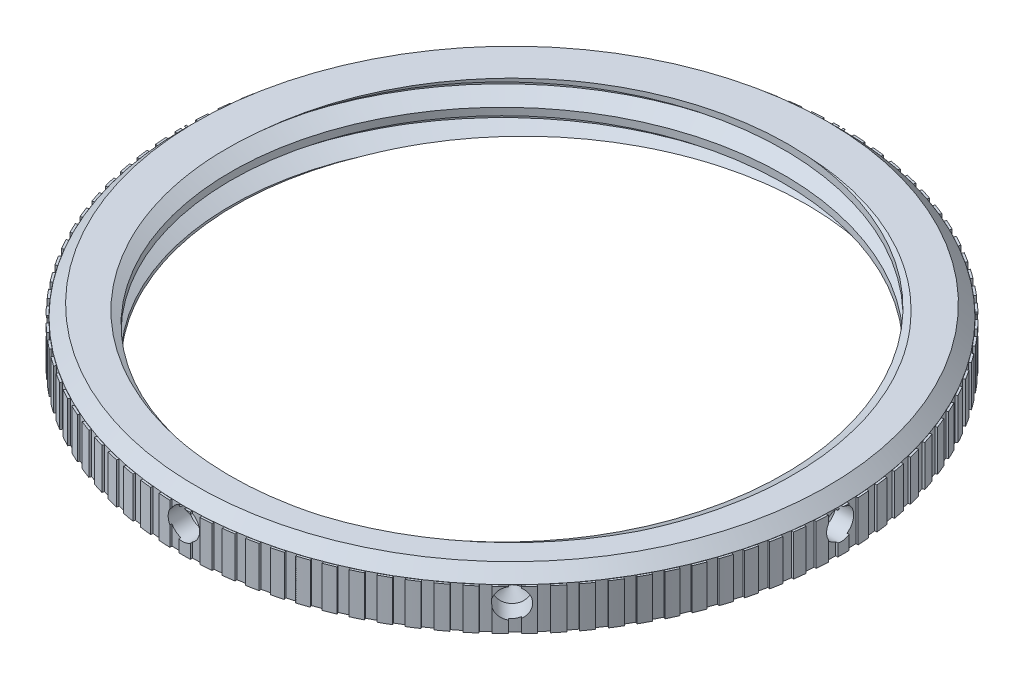
from build123d import *

# Parameters (mm, degrees)
SKETCH_1_R               = 5.6
SKETCH_1_R_2             = 5
EXTRUDE_1_DEPTH          = 0.9
CHAMFER_2_SIZE           = 0.2
THREAD_1_PITCH           = 0.5
THREAD_1_FROM            = 1
THREAD_1_TO              = 1.9
EXTRUDE_2_DEPTH          = 0.698
PATTERN_CIRCULAR_1_COUNT = 8


with BuildPart() as part:
    # Sketch 1 → 凸台-拉伸1 (new body)
    with BuildSketch(Plane.XZ.offset(4.597705057)):
        with Locations(Location((0, 0, 0), (0, 0, 270))):
            Circle(SKETCH_1_R)
        with Locations(Location((0, 0, 0), (0, 0, 270))):
            Circle(SKETCH_1_R_2, mode=Mode.SUBTRACT)
    extrude(amount=-EXTRUDE_1_DEPTH)

    # 倒角2
    chamfer_2_edges = [part.edges().sort_by_distance(p)[0] for p in [
        (0, -3.697705057, 5.6),
    ]]
    chamfer(chamfer_2_edges, length=CHAMFER_2_SIZE)

    # 螺纹线1: arcs per turn and ends read off the stored shape
    # 螺纹线1: the profile of Sketch 1 2 profile screwed along a right-hand helix through 3.8 turns, 6 arcs to a turn; built about Z, then put on its axis
    thread_1_z = Axis((0, 0, 0), (0, 0, 1))
    thread_1_corners = [(5.0003, 0, -0.000173205), (5.0003, 0, 0.437673204), (4.729367062, 0, 0.28125), (4.729367062, 0, 0.15625)]
    with BuildLine(mode=Mode.PRIVATE) as thread_1_profile:
        Line(thread_1_corners[0], thread_1_corners[1])
        Line(thread_1_corners[1], thread_1_corners[2])
        Line(thread_1_corners[2], thread_1_corners[3])
        Line(thread_1_corners[3], thread_1_corners[0])
    thread_1_cap = Face(thread_1_profile.wire())
    thread_1_turn_angles = [0, 30, 60, 90, 120, 150, 180, 210, 240, 270, 300, 330, 360]
    thread_1_turn_weights = [1, 0.8660254037844387, 1, 0.8660254037844387, 1, 0.8660254037844387, 1, 0.8660254037844387, 1, 0.8660254037844387, 1, 0.8660254037844387, 1]
    thread_1_turn_rails = [Edge.make_bspline([Vector(p[0], p[1], 0).rotate(thread_1_z, thread_1_turn_angles[k]) / thread_1_turn_weights[k] + Vector(0, 0, p[2] + THREAD_1_PITCH * thread_1_turn_angles[k] / 360) for k in range(13)], [0, 0, 0, 1, 1, 2, 2, 3, 3, 4, 4, 5, 5, 6, 6, 6], 2, thread_1_turn_weights) for p in thread_1_corners]
    thread_1_turn_sides = [Face.make_surface_from_curves(thread_1_turn_rails[p[0]], thread_1_turn_rails[p[1]]) for p in [(0, 1), (1, 2), (2, 3), (3, 0)]]
    thread_1_last_angles = [1080, 1110, 1140, 1170, 1200, 1230, 1260, 1290, 1320, 1344, 1368]
    thread_1_last_weights = [1, 0.8660254037844387, 1, 0.8660254037844387, 1, 0.8660254037844387, 1, 0.8660254037844387, 1, 0.9135454576426018, 1]
    thread_1_last_rails = [Edge.make_bspline([Vector(p[0], p[1], 0).rotate(thread_1_z, thread_1_last_angles[k]) / thread_1_last_weights[k] + Vector(0, 0, p[2] + THREAD_1_PITCH * thread_1_last_angles[k] / 360) for k in range(11)], [0, 0, 0, 1, 1, 2, 2, 3, 3, 4, 4, 5, 5, 5], 2, thread_1_last_weights) for p in thread_1_corners]
    thread_1_last_sides = [Face.make_surface_from_curves(thread_1_last_rails[p[0]], thread_1_last_rails[p[1]]) for p in [(0, 1), (1, 2), (2, 3), (3, 0)]]
    thread_1 = Plane(origin=(0, -5.597705057, 0), x_dir=(1, 0, 0), z_dir=(0, 1, 0)) * split(split(Solid(Shell([*[p.moved(Location((0, 0, THREAD_1_PITCH * i))) for i in range(3) for p in thread_1_turn_sides], *thread_1_last_sides, thread_1_cap, thread_1_cap.rotate(thread_1_z, 1368).moved(Location((0, 0, THREAD_1_PITCH * 1368 / 360)))])), bisect_by=Plane.XY.offset(THREAD_1_FROM), keep=Keep.TOP, mode=Mode.PRIVATE), bisect_by=Plane.XY.offset(THREAD_1_TO), keep=Keep.BOTTOM, mode=Mode.PRIVATE)
    add(thread_1)

    # 草图5 → 凸台-拉伸2 (add)
    with BuildSketch(Plane.XZ.offset(4.597705057)):
        with BuildLine():
            Line((3.18822103, 4.494267264), (3.341089976, 4.377593831))
            Line((3.341089976, 4.377593831), (3.419788422, 4.480706838))
            ThreePointArc((3.419788422, 4.480706838), (3.341068455, 4.539707942), (3.261330766, 4.597326207))
            Line((3.261330766, 4.597326207), (3.18822103, 4.494267264))
        make_face()
        with BuildLine():
            Line((2.966226774, 4.793035087), (2.899732428, 4.685588909))
            Line((2.899732428, 4.685588909), (3.059625707, 4.578744425))
            Line((3.059625707, 4.578744425), (3.131694341, 4.686595478))
            ThreePointArc((3.131694341, 4.686595478), (3.049424999, 4.740537289), (2.966226774, 4.793035087))
        make_face()
        with BuildLine():
            Line((2.659416439, 4.969828047), (2.599799907, 4.858418675))
            Line((2.599799907, 4.858418675), (2.766086493, 4.761824806))
            Line((2.766086493, 4.761824806), (2.831240892, 4.873988267))
            ThreePointArc((2.831240892, 4.873988267), (2.745746856, 4.922657902), (2.659416439, 4.969828047))
        make_face()
        with BuildLine():
            Line((2.342110603, 5.127007367), (2.289607163, 5.012074483))
            Line((2.289607163, 5.012074483), (2.4616308, 4.926112441))
            Line((2.4616308, 4.926112441), (2.51961383, 5.042145651))
            ThreePointArc((2.51961383, 5.042145651), (2.431232505, 5.085351033), (2.342110603, 5.127007367))
        make_face()
        with BuildLine():
            Line((2.015561527, 5.263952731), (1.970378385, 5.145949922))
            Line((1.970378385, 5.145949922), (2.147460174, 5.07095896))
            Line((2.147460174, 5.07095896), (2.198043002, 5.19040399))
            ThreePointArc((2.198043002, 5.19040399), (2.10712319, 5.227974606), (2.015561527, 5.263952731))
        make_face()
        with BuildLine():
            Line((1.68105795, 5.380123678), (1.643373425, 5.259516647))
            Line((1.643373425, 5.259516647), (1.824814505, 5.195792721))
            Line((1.824814505, 5.195792721), (1.867797503, 5.318178175))
            ThreePointArc((1.867797503, 5.318178175), (1.774698022, 5.349965752), (1.68105795, 5.380123678))
        make_face()
        with BuildLine():
            Line((1.339920005, 5.475061735), (1.30988282, 5.352326464))
            Line((1.30988282, 5.352326464), (1.494967126, 5.300121062))
            Line((1.494967126, 5.300121062), (1.530180661, 5.424963941))
            ThreePointArc((1.530180661, 5.424963941), (1.435268932, 5.450843028), (1.339920005, 5.475061735))
        make_face()
        with BuildLine():
            Line((0.993494008, 5.548392224), (0.971222706, 5.424013093))
            Line((0.971222706, 5.424013093), (1.159219795, 5.383532246))
            Line((1.159219795, 5.383532246), (1.186524895, 5.510339853))
            ThreePointArc((1.186524895, 5.510339853), (1.090175491, 5.530208316), (0.993494008, 5.548392224))
        make_face()
        with BuildLine():
            Line((0.643147145, 5.599825744), (0.62872962, 5.47429362))
            Line((0.62872962, 5.47429362), (0.818897552, 5.445697088))
            Line((0.818897552, 5.445697088), (0.838186457, 5.57396897))
            ThreePointArc((0.838186457, 5.57396897), (0.740779625, 5.587748399), (0.643147145, 5.599825744))
        make_face()
        with BuildLine():
            Line((0.290262073, 5.629159311), (0.283755225, 5.502969612))
            Line((0.283755225, 5.502969612), (0.475343496, 5.486370251))
            Line((0.475343496, 5.486370251), (0.48654008, 5.615600179))
            ThreePointArc((0.48654008, 5.615600179), (0.388460241, 5.623236191), (0.290262073, 5.629159311))
        make_face()
        with BuildLine():
            Line((-0.063768531, 5.636277157), (-0.062339022, 5.509927896))
            Line((-0.062339022, 5.509927896), (0.129913476, 5.505391218))
            Line((0.129913476, 5.505391218), (0.132973551, 5.635069179))
            ThreePointArc((0.132973551, 5.635069179), (0.034607781, 5.636531639), (-0.063768531, 5.636277157))
        make_face()
        with BuildLine():
            Line((-0.417547469, 5.621151193), (-0.408187245, 5.495141013))
            Line((-0.408187245, 5.495141013), (-0.216029254, 5.502684921))
            Line((-0.216029254, 5.502684921), (-0.221117763, 5.632299136))
            ThreePointArc((-0.221117763, 5.632299136), (-0.319381259, 5.627582272), (-0.417547469, 5.621151193))
        make_face()
        with BuildLine():
            Line((-0.769678538, 5.583841112), (-0.75242454, 5.458667318))
            Line((-0.75242454, 5.458667318), (-0.561119414, 5.47826204))
            Line((-0.561119414, 5.47826204), (-0.574336426, 5.607300981))
            ThreePointArc((-0.574336426, 5.607300981), (-0.672109848, 5.596423409), (-0.769678538, 5.583841112))
        make_face()
        with BuildLine():
            Line((-1.118772038, 5.524494162), (-1.093692359, 5.400650757))
            Line((-1.093692359, 5.400650757), (-0.903995093, 5.432218962))
            Line((-0.903995093, 5.432218962), (-0.925288446, 5.56017337))
            ThreePointArc((-0.925288446, 5.56017337), (-1.022185926, 5.543178019), (-1.118772038, 5.524494162))
        make_face()
        with BuildLine():
            Line((-1.463450255, 5.443344557), (-1.430643874, 5.321320295))
            Line((-1.430643874, 5.321320295), (-1.243303116, 5.364737397))
            Line((-1.243303116, 5.364737397), (-1.272588775, 5.491102296))
            ThreePointArc((-1.272588775, 5.491102296), (-1.368227903, 5.468056238), (-1.463450255, 5.443344557))
        make_face()
        with BuildLine():
            Line((-1.802352903, 5.340712558), (-1.761949291, 5.220989013))
            Line((-1.761949291, 5.220989013), (-1.577704389, 5.276083664))
            Line((-1.577704389, 5.276083664), (-1.614866778, 5.40036035))
            ThreePointArc((-1.614866778, 5.40036035), (-1.70887011, 5.371354537), (-1.802352903, 5.340712558))
        make_face()
        with BuildLine():
            Line((-2.134142488, 5.217003207), (-2.086301099, 5.100052872))
            Line((-2.086301099, 5.100052872), (-1.905879185, 5.16660764))
            Line((-1.905879185, 5.16660764), (-1.950771639, 5.288305648))
            ThreePointArc((-1.950771639, 5.288305648), (-2.042768187, 5.253454554), (-2.134142488, 5.217003207))
        make_face()
        with BuildLine():
            Line((-2.457509587, 5.072704727), (-2.40241923, 4.958989153))
            Line((-2.40241923, 4.958989153), (-2.226532345, 5.036741376))
            Line((-2.226532345, 5.036741376), (-2.278977696, 5.15538042))
            ThreePointArc((-2.278977696, 5.15538042), (-2.368604391, 5.114821586), (-2.457509587, 5.072704727))
        make_face()
        with BuildLine():
            Line((-2.771178018, 4.908386599), (-2.70905611, 4.798354569))
            Line((-2.70905611, 4.798354569), (-2.5383984, 4.886997395))
            Line((-2.5383984, 4.886997395), (-2.598189669, 5.002109261))
            ThreePointArc((-2.598189669, 5.002109261), (-2.685092796, 4.956002754), (-2.771178018, 4.908386599))
        make_face()
        with BuildLine():
            Line((-3.073909876, 4.724697312), (-3.005001582, 4.618783072))
            Line((-3.005001582, 4.618783072), (-2.840246556, 4.717966667))
            Line((-2.840246556, 4.717966667), (-2.907147775, 4.829097062))
            ThreePointArc((-2.907147775, 4.829097062), (-2.990984367, 4.777624842), (-3.073909876, 4.724697312))
        make_face()
        with BuildLine():
            Line((-3.364510416, 4.522361803), (-3.289087687, 4.420983348))
            Line((-3.289087687, 4.420983348), (-3.130885556, 4.530316281))
            Line((-3.130885556, 4.530316281), (-3.204632696, 4.637026623))
            ThreePointArc((-3.204632696, 4.637026623), (-3.285071888, 4.580391829), (-3.364510416, 4.522361803))
        make_face()
        with BuildLine():
            Line((-3.64183277, 4.302178598), (-3.560193265, 4.205736023))
            Line((-3.560193265, 4.205736023), (-3.409168382, 4.324786806))
            Line((-3.409168382, 4.324786806), (-3.489470396, 4.426655958))
            ThreePointArc((-3.489470396, 4.426655958), (-3.566194732, 4.365082101), (-3.64183277, 4.302178598))
        make_face()
        with BuildLine():
            Line((-3.904782474, 4.06501666), (-3.817248387, 3.973890579))
            Line((-3.817248387, 3.973890579), (-3.673996777, 4.102189373))
            Line((-3.673996777, 4.102189373), (-3.760536751, 4.198815305))
            ThreePointArc((-3.760536751, 4.198815305), (-3.833243434, 4.132545389), (-3.904782474, 4.06501666))
        make_face()
        with BuildLine():
            Line((-4.152321786, 3.811811958), (-4.059238573, 3.726362004))
            Line((-4.059238573, 3.726362004), (-3.924325586, 3.863402473))
            Line((-3.924325586, 3.863402473), (-4.016761985, 3.954403846))
            ThreePointArc((-4.016761985, 3.954403846), (-4.085164076, 3.883699408), (-4.152321786, 3.811811958))
        make_face()
        with BuildLine():
            Line((-4.383473781, 3.543563776), (-4.285208799, 3.464127181))
            Line((-4.285208799, 3.464127181), (-4.159166874, 3.609368489))
            Line((-4.159166874, 3.609368489), (-4.257134895, 3.694386161))
            ThreePointArc((-4.257134895, 3.694386161), (-4.320962441, 3.61952624), (-4.383473781, 3.543563776))
        make_face()
        with BuildLine():
            Line((-4.597326207, 3.261330766), (-4.494267264, 3.18822103))
            Line((-4.494267264, 3.18822103), (-4.377593831, 3.341089976))
            Line((-4.377593831, 3.341089976), (-4.480706838, 3.419788422))
            ThreePointArc((-4.480706838, 3.419788422), (-4.539707942, 3.341068455), (-4.597326207, 3.261330766))
        make_face()
        with BuildLine():
            Line((-4.793035087, 2.966226774), (-4.685588909, 2.899732428))
            Line((-4.685588909, 2.899732428), (-4.578744425, 3.059625707))
            Line((-4.578744425, 3.059625707), (-4.686595478, 3.131694341))
            ThreePointArc((-4.686595478, 3.131694341), (-4.740537289, 3.049424999), (-4.793035087, 2.966226774))
        make_face()
        with BuildLine():
            Line((-4.969828047, 2.659416439), (-4.858418675, 2.599799907))
            Line((-4.858418675, 2.599799907), (-4.761824806, 2.766086493))
            Line((-4.761824806, 2.766086493), (-4.873988267, 2.831240892))
            ThreePointArc((-4.873988267, 2.831240892), (-4.922657902, 2.745746856), (-4.969828047, 2.659416439))
        make_face()
        with BuildLine():
            Line((-5.127007367, 2.342110603), (-5.012074483, 2.289607163))
            Line((-5.012074483, 2.289607163), (-4.926112441, 2.4616308))
            Line((-4.926112441, 2.4616308), (-5.042145651, 2.51961383))
            ThreePointArc((-5.042145651, 2.51961383), (-5.085351033, 2.431232505), (-5.127007367, 2.342110603))
        make_face()
        with BuildLine():
            Line((-5.263952731, 2.015561527), (-5.145949922, 1.970378385))
            Line((-5.145949922, 1.970378385), (-5.07095896, 2.147460174))
            Line((-5.07095896, 2.147460174), (-5.19040399, 2.198043002))
            ThreePointArc((-5.19040399, 2.198043002), (-5.227974606, 2.10712319), (-5.263952731, 2.015561527))
        make_face()
        with BuildLine():
            Line((-5.380123678, 1.68105795), (-5.259516647, 1.643373425))
            Line((-5.259516647, 1.643373425), (-5.195792721, 1.824814505))
            Line((-5.195792721, 1.824814505), (-5.318178175, 1.867797503))
            ThreePointArc((-5.318178175, 1.867797503), (-5.349965752, 1.774698022), (-5.380123678, 1.68105795))
        make_face()
        with BuildLine():
            Line((-5.475061735, 1.339920005), (-5.352326464, 1.30988282))
            Line((-5.352326464, 1.30988282), (-5.300121062, 1.494967126))
            Line((-5.300121062, 1.494967126), (-5.424963941, 1.530180661))
            ThreePointArc((-5.424963941, 1.530180661), (-5.450843028, 1.435268932), (-5.475061735, 1.339920005))
        make_face()
        with BuildLine():
            Line((-5.548392224, 0.993494008), (-5.424013093, 0.971222706))
            Line((-5.424013093, 0.971222706), (-5.383532246, 1.159219795))
            Line((-5.383532246, 1.159219795), (-5.510339853, 1.186524895))
            ThreePointArc((-5.510339853, 1.186524895), (-5.530208316, 1.090175491), (-5.548392224, 0.993494008))
        make_face()
        with BuildLine():
            Line((-5.599825744, 0.643147145), (-5.47429362, 0.62872962))
            Line((-5.47429362, 0.62872962), (-5.445697088, 0.818897552))
            Line((-5.445697088, 0.818897552), (-5.57396897, 0.838186457))
            ThreePointArc((-5.57396897, 0.838186457), (-5.587748399, 0.740779625), (-5.599825744, 0.643147145))
        make_face()
        with BuildLine():
            Line((-5.629159311, 0.290262073), (-5.502969612, 0.283755225))
            Line((-5.502969612, 0.283755225), (-5.486370251, 0.475343496))
            Line((-5.486370251, 0.475343496), (-5.615600179, 0.48654008))
            ThreePointArc((-5.615600179, 0.48654008), (-5.623236191, 0.388460241), (-5.629159311, 0.290262073))
        make_face()
        with BuildLine():
            Line((-5.636277157, -0.063768531), (-5.509927896, -0.062339022))
            Line((-5.509927896, -0.062339022), (-5.505391218, 0.129913476))
            Line((-5.505391218, 0.129913476), (-5.635069179, 0.132973551))
            ThreePointArc((-5.635069179, 0.132973551), (-5.636531639, 0.034607781), (-5.636277157, -0.063768531))
        make_face()
        with BuildLine():
            Line((-5.621151193, -0.417547469), (-5.495141013, -0.408187245))
            Line((-5.495141013, -0.408187245), (-5.502684921, -0.216029254))
            Line((-5.502684921, -0.216029254), (-5.632299136, -0.221117763))
            ThreePointArc((-5.632299136, -0.221117763), (-5.627582272, -0.319381259), (-5.621151193, -0.417547469))
        make_face()
        with BuildLine():
            Line((-5.583841112, -0.769678538), (-5.458667318, -0.75242454))
            Line((-5.458667318, -0.75242454), (-5.47826204, -0.561119414))
            Line((-5.47826204, -0.561119414), (-5.607300981, -0.574336426))
            ThreePointArc((-5.607300981, -0.574336426), (-5.596423409, -0.672109848), (-5.583841112, -0.769678538))
        make_face()
        with BuildLine():
            Line((-5.524494162, -1.118772038), (-5.400650757, -1.093692359))
            Line((-5.400650757, -1.093692359), (-5.432218962, -0.903995093))
            Line((-5.432218962, -0.903995093), (-5.56017337, -0.925288446))
            ThreePointArc((-5.56017337, -0.925288446), (-5.543178019, -1.022185926), (-5.524494162, -1.118772038))
        make_face()
        with BuildLine():
            Line((-5.443344557, -1.463450255), (-5.321320295, -1.430643874))
            Line((-5.321320295, -1.430643874), (-5.364737397, -1.243303116))
            Line((-5.364737397, -1.243303116), (-5.491102296, -1.272588775))
            ThreePointArc((-5.491102296, -1.272588775), (-5.468056238, -1.368227903), (-5.443344557, -1.463450255))
        make_face()
        with BuildLine():
            Line((-5.340712558, -1.802352903), (-5.220989013, -1.761949291))
            Line((-5.220989013, -1.761949291), (-5.276083664, -1.577704389))
            Line((-5.276083664, -1.577704389), (-5.40036035, -1.614866778))
            ThreePointArc((-5.40036035, -1.614866778), (-5.371354537, -1.70887011), (-5.340712558, -1.802352903))
        make_face()
        with BuildLine():
            Line((-5.217003207, -2.134142488), (-5.100052872, -2.086301099))
            Line((-5.100052872, -2.086301099), (-5.16660764, -1.905879185))
            Line((-5.16660764, -1.905879185), (-5.288305648, -1.950771639))
            ThreePointArc((-5.288305648, -1.950771639), (-5.253454554, -2.042768187), (-5.217003207, -2.134142488))
        make_face()
        with BuildLine():
            Line((-5.072704727, -2.457509587), (-4.958989153, -2.40241923))
            Line((-4.958989153, -2.40241923), (-5.036741376, -2.226532345))
            Line((-5.036741376, -2.226532345), (-5.15538042, -2.278977696))
            ThreePointArc((-5.15538042, -2.278977696), (-5.114821586, -2.368604391), (-5.072704727, -2.457509587))
        make_face()
        with BuildLine():
            Line((-4.908386599, -2.771178018), (-4.798354569, -2.70905611))
            Line((-4.798354569, -2.70905611), (-4.886997395, -2.5383984))
            Line((-4.886997395, -2.5383984), (-5.002109261, -2.598189669))
            ThreePointArc((-5.002109261, -2.598189669), (-4.956002754, -2.685092796), (-4.908386599, -2.771178018))
        make_face()
        with BuildLine():
            Line((-4.724697312, -3.073909876), (-4.618783072, -3.005001582))
            Line((-4.618783072, -3.005001582), (-4.717966667, -2.840246556))
            Line((-4.717966667, -2.840246556), (-4.829097062, -2.907147775))
            ThreePointArc((-4.829097062, -2.907147775), (-4.777624842, -2.990984367), (-4.724697312, -3.073909876))
        make_face()
        with BuildLine():
            Line((-4.522361803, -3.364510416), (-4.420983348, -3.289087687))
            Line((-4.420983348, -3.289087687), (-4.530316281, -3.130885556))
            Line((-4.530316281, -3.130885556), (-4.637026623, -3.204632696))
            ThreePointArc((-4.637026623, -3.204632696), (-4.580391829, -3.285071888), (-4.522361803, -3.364510416))
        make_face()
        with BuildLine():
            Line((-4.302178598, -3.64183277), (-4.205736023, -3.560193265))
            Line((-4.205736023, -3.560193265), (-4.324786806, -3.409168382))
            Line((-4.324786806, -3.409168382), (-4.426655958, -3.489470396))
            ThreePointArc((-4.426655958, -3.489470396), (-4.365082101, -3.566194732), (-4.302178598, -3.64183277))
        make_face()
        with BuildLine():
            Line((-4.06501666, -3.904782474), (-3.973890579, -3.817248387))
            Line((-3.973890579, -3.817248387), (-4.102189373, -3.673996777))
            Line((-4.102189373, -3.673996777), (-4.198815305, -3.760536751))
            ThreePointArc((-4.198815305, -3.760536751), (-4.132545389, -3.833243434), (-4.06501666, -3.904782474))
        make_face()
        with BuildLine():
            Line((-3.811811958, -4.152321786), (-3.726362004, -4.059238573))
            Line((-3.726362004, -4.059238573), (-3.863402473, -3.924325586))
            Line((-3.863402473, -3.924325586), (-3.954403846, -4.016761985))
            ThreePointArc((-3.954403846, -4.016761985), (-3.883699408, -4.085164076), (-3.811811958, -4.152321786))
        make_face()
        with BuildLine():
            Line((-3.543563776, -4.383473781), (-3.464127181, -4.285208799))
            Line((-3.464127181, -4.285208799), (-3.609368489, -4.159166874))
            Line((-3.609368489, -4.159166874), (-3.694386161, -4.257134895))
            ThreePointArc((-3.694386161, -4.257134895), (-3.61952624, -4.320962441), (-3.543563776, -4.383473781))
        make_face()
        with BuildLine():
            Line((-3.261330766, -4.597326207), (-3.18822103, -4.494267264))
            Line((-3.18822103, -4.494267264), (-3.341089976, -4.377593831))
            Line((-3.341089976, -4.377593831), (-3.419788422, -4.480706838))
            ThreePointArc((-3.419788422, -4.480706838), (-3.341068455, -4.539707942), (-3.261330766, -4.597326207))
        make_face()
        with BuildLine():
            Line((-2.966226774, -4.793035087), (-2.899732428, -4.685588909))
            Line((-2.899732428, -4.685588909), (-3.059625707, -4.578744425))
            Line((-3.059625707, -4.578744425), (-3.131694341, -4.686595478))
            ThreePointArc((-3.131694341, -4.686595478), (-3.049424999, -4.740537289), (-2.966226774, -4.793035087))
        make_face()
        with BuildLine():
            Line((-2.659416439, -4.969828047), (-2.599799907, -4.858418675))
            Line((-2.599799907, -4.858418675), (-2.766086493, -4.761824806))
            Line((-2.766086493, -4.761824806), (-2.831240892, -4.873988267))
            ThreePointArc((-2.831240892, -4.873988267), (-2.745746856, -4.922657902), (-2.659416439, -4.969828047))
        make_face()
        with BuildLine():
            Line((-2.342110603, -5.127007367), (-2.289607163, -5.012074483))
            Line((-2.289607163, -5.012074483), (-2.4616308, -4.926112441))
            Line((-2.4616308, -4.926112441), (-2.51961383, -5.042145651))
            ThreePointArc((-2.51961383, -5.042145651), (-2.431232505, -5.085351033), (-2.342110603, -5.127007367))
        make_face()
        with BuildLine():
            Line((-2.015561527, -5.263952731), (-1.970378385, -5.145949922))
            Line((-1.970378385, -5.145949922), (-2.147460174, -5.07095896))
            Line((-2.147460174, -5.07095896), (-2.198043002, -5.19040399))
            ThreePointArc((-2.198043002, -5.19040399), (-2.10712319, -5.227974606), (-2.015561527, -5.263952731))
        make_face()
        with BuildLine():
            Line((-1.68105795, -5.380123678), (-1.643373425, -5.259516647))
            Line((-1.643373425, -5.259516647), (-1.824814505, -5.195792721))
            Line((-1.824814505, -5.195792721), (-1.867797503, -5.318178175))
            ThreePointArc((-1.867797503, -5.318178175), (-1.774698022, -5.349965752), (-1.68105795, -5.380123678))
        make_face()
        with BuildLine():
            Line((-1.339920005, -5.475061735), (-1.30988282, -5.352326464))
            Line((-1.30988282, -5.352326464), (-1.494967126, -5.300121062))
            Line((-1.494967126, -5.300121062), (-1.530180661, -5.424963941))
            ThreePointArc((-1.530180661, -5.424963941), (-1.435268932, -5.450843028), (-1.339920005, -5.475061735))
        make_face()
        with BuildLine():
            Line((-0.993494008, -5.548392224), (-0.971222706, -5.424013093))
            Line((-0.971222706, -5.424013093), (-1.159219795, -5.383532246))
            Line((-1.159219795, -5.383532246), (-1.186524895, -5.510339853))
            ThreePointArc((-1.186524895, -5.510339853), (-1.090175491, -5.530208316), (-0.993494008, -5.548392224))
        make_face()
        with BuildLine():
            Line((-0.643147145, -5.599825744), (-0.62872962, -5.47429362))
            Line((-0.62872962, -5.47429362), (-0.818897552, -5.445697088))
            Line((-0.818897552, -5.445697088), (-0.838186457, -5.57396897))
            ThreePointArc((-0.838186457, -5.57396897), (-0.740779625, -5.587748399), (-0.643147145, -5.599825744))
        make_face()
        with BuildLine():
            Line((-0.290262073, -5.629159311), (-0.283755225, -5.502969612))
            Line((-0.283755225, -5.502969612), (-0.475343496, -5.486370251))
            Line((-0.475343496, -5.486370251), (-0.48654008, -5.615600179))
            ThreePointArc((-0.48654008, -5.615600179), (-0.388460241, -5.623236191), (-0.290262073, -5.629159311))
        make_face()
        with BuildLine():
            Line((0.063768531, -5.636277157), (0.062339022, -5.509927896))
            Line((0.062339022, -5.509927896), (-0.129913476, -5.505391218))
            Line((-0.129913476, -5.505391218), (-0.132973551, -5.635069179))
            ThreePointArc((-0.132973551, -5.635069179), (-0.034607781, -5.636531639), (0.063768531, -5.636277157))
        make_face()
        with BuildLine():
            Line((0.417547469, -5.621151193), (0.408187245, -5.495141013))
            Line((0.408187245, -5.495141013), (0.216029254, -5.502684921))
            Line((0.216029254, -5.502684921), (0.221117763, -5.632299136))
            ThreePointArc((0.221117763, -5.632299136), (0.319381259, -5.627582272), (0.417547469, -5.621151193))
        make_face()
        with BuildLine():
            Line((0.769678538, -5.583841112), (0.75242454, -5.458667318))
            Line((0.75242454, -5.458667318), (0.561119414, -5.47826204))
            Line((0.561119414, -5.47826204), (0.574336426, -5.607300981))
            ThreePointArc((0.574336426, -5.607300981), (0.672109848, -5.596423409), (0.769678538, -5.583841112))
        make_face()
        with BuildLine():
            Line((1.118772038, -5.524494162), (1.093692359, -5.400650757))
            Line((1.093692359, -5.400650757), (0.903995093, -5.432218962))
            Line((0.903995093, -5.432218962), (0.925288446, -5.56017337))
            ThreePointArc((0.925288446, -5.56017337), (1.022185926, -5.543178019), (1.118772038, -5.524494162))
        make_face()
        with BuildLine():
            Line((1.463450255, -5.443344557), (1.430643874, -5.321320295))
            Line((1.430643874, -5.321320295), (1.243303116, -5.364737397))
            Line((1.243303116, -5.364737397), (1.272588775, -5.491102296))
            ThreePointArc((1.272588775, -5.491102296), (1.368227903, -5.468056238), (1.463450255, -5.443344557))
        make_face()
        with BuildLine():
            Line((1.802352903, -5.340712558), (1.761949291, -5.220989013))
            Line((1.761949291, -5.220989013), (1.577704389, -5.276083664))
            Line((1.577704389, -5.276083664), (1.614866778, -5.40036035))
            ThreePointArc((1.614866778, -5.40036035), (1.70887011, -5.371354537), (1.802352903, -5.340712558))
        make_face()
        with BuildLine():
            Line((2.134142488, -5.217003207), (2.086301099, -5.100052872))
            Line((2.086301099, -5.100052872), (1.905879185, -5.16660764))
            Line((1.905879185, -5.16660764), (1.950771639, -5.288305648))
            ThreePointArc((1.950771639, -5.288305648), (2.042768187, -5.253454554), (2.134142488, -5.217003207))
        make_face()
        with BuildLine():
            Line((2.457509587, -5.072704727), (2.40241923, -4.958989153))
            Line((2.40241923, -4.958989153), (2.226532345, -5.036741376))
            Line((2.226532345, -5.036741376), (2.278977696, -5.15538042))
            ThreePointArc((2.278977696, -5.15538042), (2.368604391, -5.114821586), (2.457509587, -5.072704727))
        make_face()
        with BuildLine():
            Line((2.771178018, -4.908386599), (2.70905611, -4.798354569))
            Line((2.70905611, -4.798354569), (2.5383984, -4.886997395))
            Line((2.5383984, -4.886997395), (2.598189669, -5.002109261))
            ThreePointArc((2.598189669, -5.002109261), (2.685092796, -4.956002754), (2.771178018, -4.908386599))
        make_face()
        with BuildLine():
            Line((3.073909876, -4.724697312), (3.005001582, -4.618783072))
            Line((3.005001582, -4.618783072), (2.840246556, -4.717966667))
            Line((2.840246556, -4.717966667), (2.907147775, -4.829097062))
            ThreePointArc((2.907147775, -4.829097062), (2.990984367, -4.777624842), (3.073909876, -4.724697312))
        make_face()
        with BuildLine():
            Line((3.364510416, -4.522361803), (3.289087687, -4.420983348))
            Line((3.289087687, -4.420983348), (3.130885556, -4.530316281))
            Line((3.130885556, -4.530316281), (3.204632696, -4.637026623))
            ThreePointArc((3.204632696, -4.637026623), (3.285071888, -4.580391829), (3.364510416, -4.522361803))
        make_face()
        with BuildLine():
            Line((3.64183277, -4.302178598), (3.560193265, -4.205736023))
            Line((3.560193265, -4.205736023), (3.409168382, -4.324786806))
            Line((3.409168382, -4.324786806), (3.489470396, -4.426655958))
            ThreePointArc((3.489470396, -4.426655958), (3.566194732, -4.365082101), (3.64183277, -4.302178598))
        make_face()
        with BuildLine():
            Line((3.904782474, -4.06501666), (3.817248387, -3.973890579))
            Line((3.817248387, -3.973890579), (3.673996777, -4.102189373))
            Line((3.673996777, -4.102189373), (3.760536751, -4.198815305))
            ThreePointArc((3.760536751, -4.198815305), (3.833243434, -4.132545389), (3.904782474, -4.06501666))
        make_face()
        with BuildLine():
            Line((4.152321786, -3.811811958), (4.059238573, -3.726362004))
            Line((4.059238573, -3.726362004), (3.924325586, -3.863402473))
            Line((3.924325586, -3.863402473), (4.016761985, -3.954403846))
            ThreePointArc((4.016761985, -3.954403846), (4.085164076, -3.883699408), (4.152321786, -3.811811958))
        make_face()
        with BuildLine():
            Line((4.383473781, -3.543563776), (4.285208799, -3.464127181))
            Line((4.285208799, -3.464127181), (4.159166874, -3.609368489))
            Line((4.159166874, -3.609368489), (4.257134895, -3.694386161))
            ThreePointArc((4.257134895, -3.694386161), (4.320962441, -3.61952624), (4.383473781, -3.543563776))
        make_face()
        with BuildLine():
            Line((4.597326207, -3.261330766), (4.494267264, -3.18822103))
            Line((4.494267264, -3.18822103), (4.377593831, -3.341089976))
            Line((4.377593831, -3.341089976), (4.480706838, -3.419788422))
            ThreePointArc((4.480706838, -3.419788422), (4.539707942, -3.341068455), (4.597326207, -3.261330766))
        make_face()
        with BuildLine():
            Line((4.793035087, -2.966226774), (4.685588909, -2.899732428))
            Line((4.685588909, -2.899732428), (4.578744425, -3.059625707))
            Line((4.578744425, -3.059625707), (4.686595478, -3.131694341))
            ThreePointArc((4.686595478, -3.131694341), (4.740537289, -3.049424999), (4.793035087, -2.966226774))
        make_face()
        with BuildLine():
            Line((4.969828047, -2.659416439), (4.858418675, -2.599799907))
            Line((4.858418675, -2.599799907), (4.761824806, -2.766086493))
            Line((4.761824806, -2.766086493), (4.873988267, -2.831240892))
            ThreePointArc((4.873988267, -2.831240892), (4.922657902, -2.745746856), (4.969828047, -2.659416439))
        make_face()
        with BuildLine():
            Line((5.127007367, -2.342110603), (5.012074483, -2.289607163))
            Line((5.012074483, -2.289607163), (4.926112441, -2.4616308))
            Line((4.926112441, -2.4616308), (5.042145651, -2.51961383))
            ThreePointArc((5.042145651, -2.51961383), (5.085351033, -2.431232505), (5.127007367, -2.342110603))
        make_face()
        with BuildLine():
            Line((5.263952731, -2.015561527), (5.145949922, -1.970378385))
            Line((5.145949922, -1.970378385), (5.07095896, -2.147460174))
            Line((5.07095896, -2.147460174), (5.19040399, -2.198043002))
            ThreePointArc((5.19040399, -2.198043002), (5.227974606, -2.10712319), (5.263952731, -2.015561527))
        make_face()
        with BuildLine():
            Line((5.380123678, -1.68105795), (5.259516647, -1.643373425))
            Line((5.259516647, -1.643373425), (5.195792721, -1.824814505))
            Line((5.195792721, -1.824814505), (5.318178175, -1.867797503))
            ThreePointArc((5.318178175, -1.867797503), (5.349965752, -1.774698022), (5.380123678, -1.68105795))
        make_face()
        with BuildLine():
            Line((5.475061735, -1.339920005), (5.352326464, -1.30988282))
            Line((5.352326464, -1.30988282), (5.300121062, -1.494967126))
            Line((5.300121062, -1.494967126), (5.424963941, -1.530180661))
            ThreePointArc((5.424963941, -1.530180661), (5.450843028, -1.435268932), (5.475061735, -1.339920005))
        make_face()
        with BuildLine():
            Line((5.548392224, -0.993494008), (5.424013093, -0.971222706))
            Line((5.424013093, -0.971222706), (5.383532246, -1.159219795))
            Line((5.383532246, -1.159219795), (5.510339853, -1.186524895))
            ThreePointArc((5.510339853, -1.186524895), (5.530208316, -1.090175491), (5.548392224, -0.993494008))
        make_face()
        with BuildLine():
            Line((5.599825744, -0.643147145), (5.47429362, -0.62872962))
            Line((5.47429362, -0.62872962), (5.445697088, -0.818897552))
            Line((5.445697088, -0.818897552), (5.57396897, -0.838186457))
            ThreePointArc((5.57396897, -0.838186457), (5.587748399, -0.740779625), (5.599825744, -0.643147145))
        make_face()
        with BuildLine():
            Line((5.629159311, -0.290262073), (5.502969612, -0.283755225))
            Line((5.502969612, -0.283755225), (5.486370251, -0.475343496))
            Line((5.486370251, -0.475343496), (5.615600179, -0.48654008))
            ThreePointArc((5.615600179, -0.48654008), (5.623236191, -0.388460241), (5.629159311, -0.290262073))
        make_face()
        with BuildLine():
            Line((5.636277157, 0.063768531), (5.509927896, 0.062339022))
            Line((5.509927896, 0.062339022), (5.505391218, -0.129913476))
            Line((5.505391218, -0.129913476), (5.635069179, -0.132973551))
            ThreePointArc((5.635069179, -0.132973551), (5.636531639, -0.034607781), (5.636277157, 0.063768531))
        make_face()
        with BuildLine():
            Line((5.621151193, 0.417547469), (5.495141013, 0.408187245))
            Line((5.495141013, 0.408187245), (5.502684921, 0.216029254))
            Line((5.502684921, 0.216029254), (5.632299136, 0.221117763))
            ThreePointArc((5.632299136, 0.221117763), (5.627582272, 0.319381259), (5.621151193, 0.417547469))
        make_face()
        with BuildLine():
            Line((5.583841112, 0.769678538), (5.458667318, 0.75242454))
            Line((5.458667318, 0.75242454), (5.47826204, 0.561119414))
            Line((5.47826204, 0.561119414), (5.607300981, 0.574336426))
            ThreePointArc((5.607300981, 0.574336426), (5.596423409, 0.672109848), (5.583841112, 0.769678538))
        make_face()
        with BuildLine():
            Line((5.524494162, 1.118772038), (5.400650757, 1.093692359))
            Line((5.400650757, 1.093692359), (5.432218962, 0.903995093))
            Line((5.432218962, 0.903995093), (5.56017337, 0.925288446))
            ThreePointArc((5.56017337, 0.925288446), (5.543178019, 1.022185926), (5.524494162, 1.118772038))
        make_face()
        with BuildLine():
            Line((5.443344557, 1.463450255), (5.321320295, 1.430643874))
            Line((5.321320295, 1.430643874), (5.364737397, 1.243303116))
            Line((5.364737397, 1.243303116), (5.491102296, 1.272588775))
            ThreePointArc((5.491102296, 1.272588775), (5.468056238, 1.368227903), (5.443344557, 1.463450255))
        make_face()
        with BuildLine():
            Line((5.340712558, 1.802352903), (5.220989013, 1.761949291))
            Line((5.220989013, 1.761949291), (5.276083664, 1.577704389))
            Line((5.276083664, 1.577704389), (5.40036035, 1.614866778))
            ThreePointArc((5.40036035, 1.614866778), (5.371354537, 1.70887011), (5.340712558, 1.802352903))
        make_face()
        with BuildLine():
            Line((5.217003207, 2.134142488), (5.100052872, 2.086301099))
            Line((5.100052872, 2.086301099), (5.16660764, 1.905879185))
            Line((5.16660764, 1.905879185), (5.288305648, 1.950771639))
            ThreePointArc((5.288305648, 1.950771639), (5.253454554, 2.042768187), (5.217003207, 2.134142488))
        make_face()
        with BuildLine():
            Line((5.072704727, 2.457509587), (4.958989153, 2.40241923))
            Line((4.958989153, 2.40241923), (5.036741376, 2.226532345))
            Line((5.036741376, 2.226532345), (5.15538042, 2.278977696))
            ThreePointArc((5.15538042, 2.278977696), (5.114821586, 2.368604391), (5.072704727, 2.457509587))
        make_face()
        with BuildLine():
            Line((4.908386599, 2.771178018), (4.798354569, 2.70905611))
            Line((4.798354569, 2.70905611), (4.886997395, 2.5383984))
            Line((4.886997395, 2.5383984), (5.002109261, 2.598189669))
            ThreePointArc((5.002109261, 2.598189669), (4.956002754, 2.685092796), (4.908386599, 2.771178018))
        make_face()
        with BuildLine():
            Line((4.724697312, 3.073909876), (4.618783072, 3.005001582))
            Line((4.618783072, 3.005001582), (4.717966667, 2.840246556))
            Line((4.717966667, 2.840246556), (4.829097062, 2.907147775))
            ThreePointArc((4.829097062, 2.907147775), (4.777624842, 2.990984367), (4.724697312, 3.073909876))
        make_face()
        with BuildLine():
            Line((4.522361803, 3.364510416), (4.420983348, 3.289087687))
            Line((4.420983348, 3.289087687), (4.530316281, 3.130885556))
            Line((4.530316281, 3.130885556), (4.637026623, 3.204632696))
            ThreePointArc((4.637026623, 3.204632696), (4.580391829, 3.285071888), (4.522361803, 3.364510416))
        make_face()
        with BuildLine():
            Line((4.302178598, 3.64183277), (4.205736023, 3.560193265))
            Line((4.205736023, 3.560193265), (4.324786806, 3.409168382))
            Line((4.324786806, 3.409168382), (4.426655958, 3.489470396))
            ThreePointArc((4.426655958, 3.489470396), (4.365082101, 3.566194732), (4.302178598, 3.64183277))
        make_face()
        with BuildLine():
            Line((4.06501666, 3.904782474), (3.973890579, 3.817248387))
            Line((3.973890579, 3.817248387), (4.102189373, 3.673996777))
            Line((4.102189373, 3.673996777), (4.198815305, 3.760536751))
            ThreePointArc((4.198815305, 3.760536751), (4.132545389, 3.833243434), (4.06501666, 3.904782474))
        make_face()
        with BuildLine():
            Line((3.811811958, 4.152321786), (3.726362004, 4.059238573))
            Line((3.726362004, 4.059238573), (3.863402473, 3.924325586))
            Line((3.863402473, 3.924325586), (3.954403846, 4.016761985))
            ThreePointArc((3.954403846, 4.016761985), (3.883699408, 4.085164076), (3.811811958, 4.152321786))
        make_face()
        with BuildLine():
            Line((3.543563776, 4.383473781), (3.464127181, 4.285208799))
            Line((3.464127181, 4.285208799), (3.609368489, 4.159166874))
            Line((3.609368489, 4.159166874), (3.694386161, 4.257134895))
            ThreePointArc((3.694386161, 4.257134895), (3.61952624, 4.320962441), (3.543563776, 4.383473781))
        make_face()
    extrude(amount=-EXTRUDE_2_DEPTH)

    # 草图8 → Ø1.0mm 暗销孔1 (revolve, cut)
    with BuildSketch(Plane(origin=(0, -4.147705057, 5.636637882), x_dir=(0, -1, 0), z_dir=(1, 0, 0))):
        Polygon((0, 0), (0, 0.5), (0.25, 0.349784845), (0.25, 0), align=None)
    f_1_0mm_1 = revolve(axis=Axis((0, -4.147705057, 11.986637882), (0, 0, -1)), mode=Mode.SUBTRACT)

    # 阵列(圆周)1: Ø1.0mm 暗销孔1 ×8 about axis
    pattern_circular_1_axis = Axis((0, 0, 0), (0, -1, 0))
    for i in range(1, PATTERN_CIRCULAR_1_COUNT):
        add(f_1_0mm_1.rotate(pattern_circular_1_axis, i * 360 / PATTERN_CIRCULAR_1_COUNT), mode=Mode.SUBTRACT)


solid = part.part
